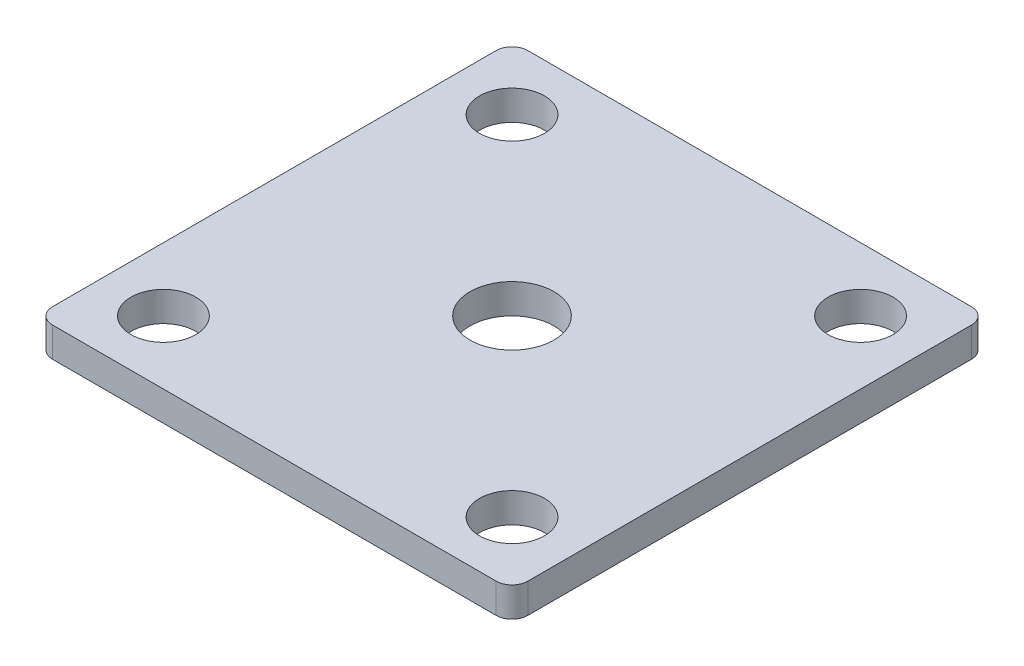
from build123d import *

# Parameters (mm, degrees)
SKETCH2_W           = 38.1
SKETCH2_H           = 38.1
SKETCH2_R           = 2.6035
SKETCH2_R_2         = 3.3655
BOSS_EXTRUDE1_DEPTH = 2.38125
FILLET1_R           = 1.27


with BuildPart() as part:
    # Sketch2 → Boss-Extrude1 (new body)
    with BuildSketch(Plane(origin=(0, 0, 0), x_dir=(1, 0, 0), z_dir=(0, 1, 0))):
        Rectangle(SKETCH2_W, SKETCH2_H)
        with Locations((-13.97, 13.97)):
            Circle(SKETCH2_R, mode=Mode.SUBTRACT)
        with Locations((-13.97, -13.97)):
            Circle(SKETCH2_R, mode=Mode.SUBTRACT)
        with Locations((13.97, -13.97)):
            Circle(SKETCH2_R, mode=Mode.SUBTRACT)
        with Locations((13.97, 13.97)):
            Circle(SKETCH2_R, mode=Mode.SUBTRACT)
        Circle(SKETCH2_R_2, mode=Mode.SUBTRACT)
    extrude(amount=BOSS_EXTRUDE1_DEPTH)

    # Fillet1
    fillet1_edges = [part.edges().sort_by_distance(p)[0] for p in [
        (-19.05, 1.190625, -19.05),
        (19.05, 1.190625, -19.05),
        (19.05, 1.190625, 19.05),
        (-19.05, 1.190625, 19.05),
    ]]
    fillet(fillet1_edges, radius=FILLET1_R)


solid = part.part
